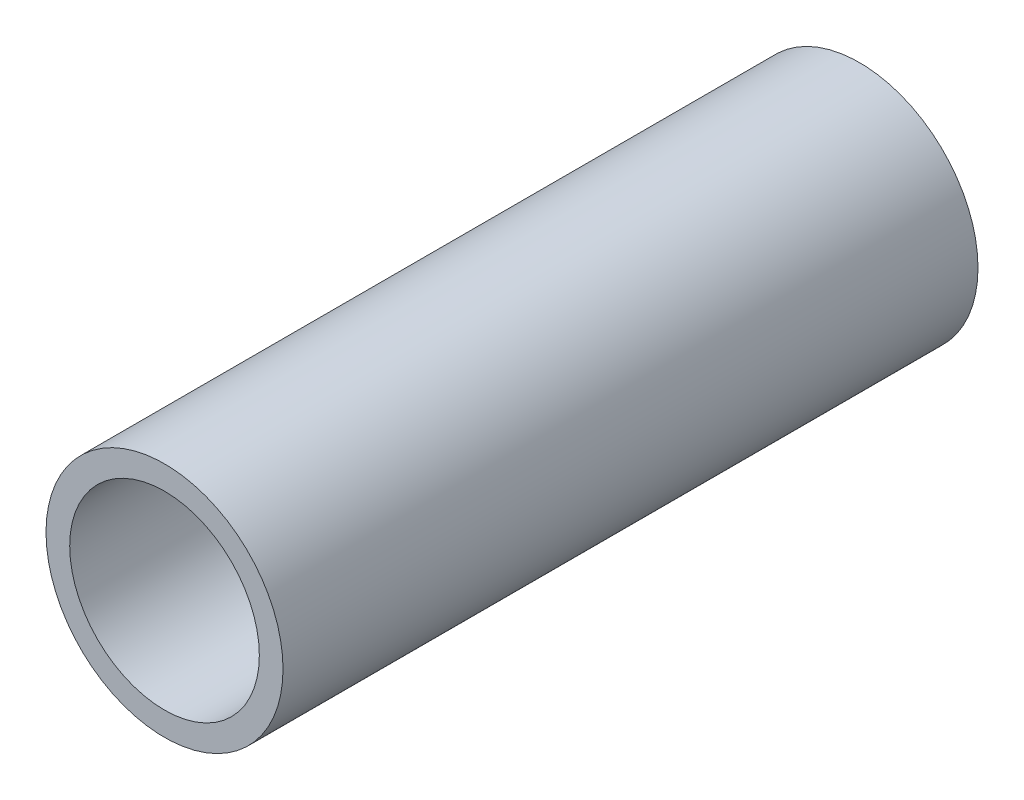
from build123d import *

# Parameters (mm, degrees)
SKETCH1_R           = 1.25
SKETCH1_R_2         = 1
BOSS_EXTRUDE1_DEPTH = 7.33


with BuildPart() as part:
    # Sketch1 → Boss-Extrude1 (new body)
    with BuildSketch(Plane.XY):
        Circle(SKETCH1_R)
        Circle(SKETCH1_R_2, mode=Mode.SUBTRACT)
    extrude(amount=BOSS_EXTRUDE1_DEPTH)


solid = part.part
